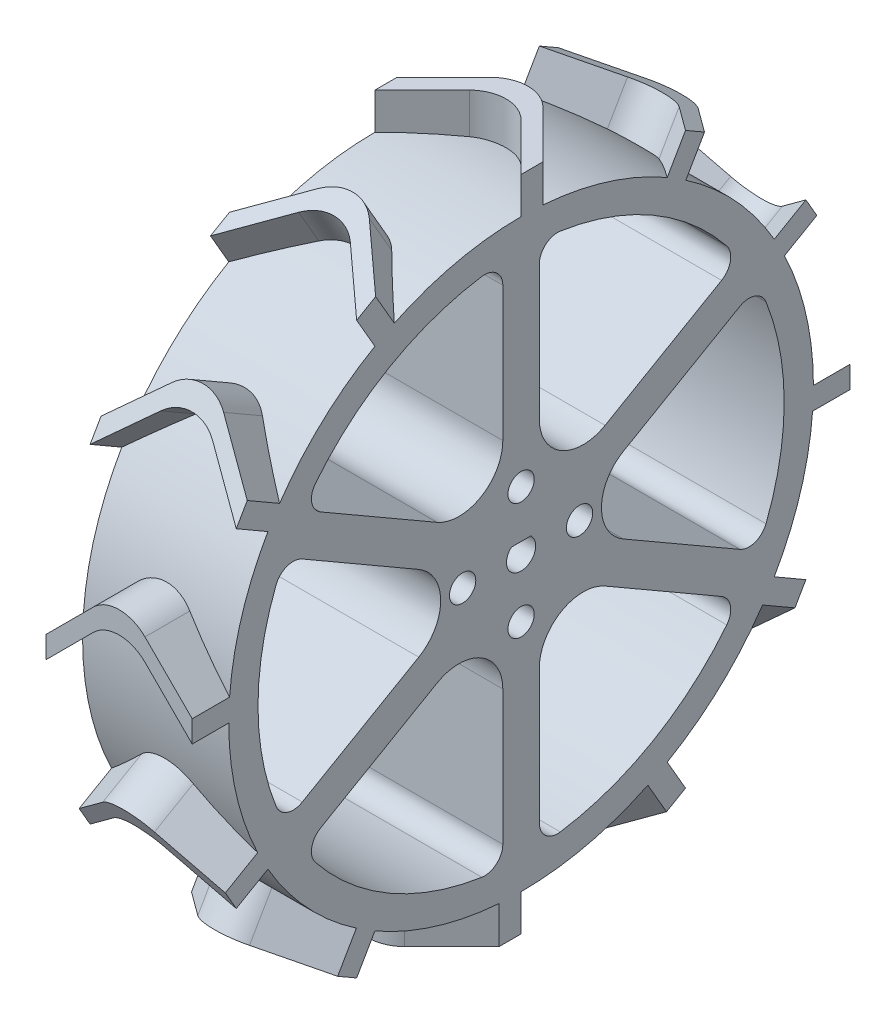
from build123d import *

# Parameters (mm, degrees)
SKETCH2_R                = 40
BOSS_EXTRUDE1_DEPTH      = 20
BOSS_EXTRUDE2_DEPTH      = 45
CIRPATTERN2_COUNT        = 12
CUT_EXTRUDE3_REACH       = 68.708
FILLET1_R                = 6
CIRPATTERN3_COUNT        = 6
FILLET1_OF_CIRPATTERN3_R = 6
CUT_EXTRUDE4_REACH       = 68.708
SKETCH6_R                = 1.7999999999999998
SKETCH6_R_2              = 1.799999999999999
SKETCH6_R_3              = 1.8000000000000003
CUT_EXTRUDE6_DEPTH       = 67.70832048552884
CUT_EXTRUDE6_DEPTH_BACK  = 67.70832048552884


with BuildPart() as part:
    # Sketch2 → Boss-Extrude1 (new body)
    with BuildSketch(Plane(origin=(0, 0, 0), x_dir=(0, 0, -1), z_dir=(1, 0, 0))):
        Circle(SKETCH2_R)
    extrude(amount=BOSS_EXTRUDE1_DEPTH)

    # Sketch4 → Boss-Extrude2 (add)
    with BuildSketch(Plane(origin=(0, 0, 0), x_dir=(1, 0, 0), z_dir=(0, 1, 0))):
        with BuildLine():
            Line((0, 0), (6.464466094067264, 6.464466094067263))
            ThreePointArc((6.464466094067264, 6.464466094067263), (10, 7.9289321881345245), (13.535533905932738, 6.464466094067263))
            Line((13.535533905932738, 6.464466094067263), (20, 0))
            Line((20, 0), (20, 3))
            Line((20, 3), (13.53553390593274, 9.464466094067264))
            ThreePointArc((13.53553390593274, 9.464466094067264), (10, 10.928932188134528), (6.464466094067261, 9.464466094067264))
            Line((6.464466094067261, 9.464466094067264), (0, 3))
            Line((0, 3), (0, 0))
        make_face()
    boss_extrude2 = extrude(amount=BOSS_EXTRUDE2_DEPTH)

    # CirPattern2: Boss-Extrude2 ×12 about axis
    cirpattern2_axis = Axis((20, 0, 0), (-1, 0, 0))
    for i in range(1, CIRPATTERN2_COUNT):
        add(boss_extrude2.rotate(cirpattern2_axis, i * 360 / CIRPATTERN2_COUNT))

    # Sketch5 → Cut-Extrude3 (cut, up to next)
    with BuildSketch(Plane.ZY, mode=Mode.PRIVATE) as cut_extrude3_sk1:
        with BuildLine():
            Line((2.499999999999992, 33.12476415010377), (2.4999999999999987, 4.330127018922181))
            Line((2.4999999999999987, 4.330127018922181), (27.436887248357948, 18.727445584512928))
            ThreePointArc((27.436887248357948, 18.727445584512928), (28.6433531155643, 20.427992739848364), (28.141132565399595, 22.451651563673586))
            ThreePointArc((28.141132565399595, 22.451651563673586), (18.000000000000025, 31.176914536239778), (5.3731343283582, 35.59676147473838))
            ThreePointArc((5.3731343283582, 35.59676147473838), (3.3694841032506733, 35.019867817571004), (2.499999999999992, 33.12476415010377))
        make_face()
    cut_extrude3_tool1 = extrude(cut_extrude3_sk1.sketch, amount=-CUT_EXTRUDE3_REACH, mode=Mode.PRIVATE) & part.part
    cut_extrude3 = cut_extrude3_tool1.solids().sort_by_distance((0, 21.473973, 12.398004))[0]
    add(cut_extrude3, mode=Mode.SUBTRACT)

    # Fillet1
    fillet1_edges = [part.edges().sort_by_distance(p)[0] for p in [
        (10, 4.330127018922181, 2.4999999999999987),
    ]]
    fillet(fillet1_edges, radius=FILLET1_R)

    # CirPattern3: Cut-Extrude3 ×6 about axis
    cirpattern3_axis = Axis((0, 0, 0), (1, 0, 0))
    for i in range(1, CIRPATTERN3_COUNT):
        add(cut_extrude3.rotate(cirpattern3_axis, i * 360 / CIRPATTERN3_COUNT), mode=Mode.SUBTRACT)

    # Fillet1 of CirPattern3
    fillet1_of_cirpattern3_edges = [part.edges().sort_by_distance(p)[0] for p in [
        (10, -4.44e-15, 4.999999999999989),
        (10, -4.330127018922186, 2.499999999999991),
        (10, -4.330127018922181, -2.4999999999999982),
        (10, 2.22e-15, -4.999999999999989),
        (10, 4.3301270189221865, -2.49999999999999),
    ]]
    fillet(fillet1_of_cirpattern3_edges, radius=FILLET1_OF_CIRPATTERN3_R)

    # Sketch6 → Cut-Extrude4 (cut, up to next)
    with BuildSketch(Plane.ZY, mode=Mode.PRIVATE) as cut_extrude4_sk1:
        with Locations((0, 8)):
            Circle(SKETCH6_R)
    cut_extrude4_tool1 = extrude(cut_extrude4_sk1.sketch, amount=-CUT_EXTRUDE4_REACH, mode=Mode.PRIVATE) & part.part
    # Sketch6 → Cut-Extrude4 (cut, up to next)
    with BuildSketch(Plane.ZY, mode=Mode.PRIVATE) as cut_extrude4_sk2:
        with Locations((8, 4.3e-16)):
            Circle(SKETCH6_R_2)
    cut_extrude4_tool2 = extrude(cut_extrude4_sk2.sketch, amount=-CUT_EXTRUDE4_REACH, mode=Mode.PRIVATE) & part.part
    # Sketch6 → Cut-Extrude4 (cut, up to next)
    with BuildSketch(Plane.ZY, mode=Mode.PRIVATE) as cut_extrude4_sk3:
        with Locations((9.8e-16, -8)):
            Circle(SKETCH6_R_3)
    cut_extrude4_tool3 = extrude(cut_extrude4_sk3.sketch, amount=-CUT_EXTRUDE4_REACH, mode=Mode.PRIVATE) & part.part
    # Sketch6 → Cut-Extrude4 (cut, up to next)
    with BuildSketch(Plane.ZY, mode=Mode.PRIVATE) as cut_extrude4_sk4:
        with Locations((-8, 6.5e-16)):
            Circle(SKETCH6_R)
    cut_extrude4_tool4 = extrude(cut_extrude4_sk4.sketch, amount=-CUT_EXTRUDE4_REACH, mode=Mode.PRIVATE) & part.part
    add(cut_extrude4_tool1.solids().sort_by_distance((0, 8, 0))[0], mode=Mode.SUBTRACT)
    add(cut_extrude4_tool2.solids().sort_by_distance((0, 0, 8))[0], mode=Mode.SUBTRACT)
    add(cut_extrude4_tool3.solids().sort_by_distance((0, -8, 0))[0], mode=Mode.SUBTRACT)
    add(cut_extrude4_tool4.solids().sort_by_distance((0, 0, -8))[0], mode=Mode.SUBTRACT)

    # Sketch8 → Cut-Extrude6 (cut, two sides: drawn at the far end of the back side and taken through both)
    with BuildSketch(Plane(origin=(0, 0, 0), x_dir=(0, 0, -1), z_dir=(1, 0, 0)).offset(-CUT_EXTRUDE6_DEPTH_BACK)):
        with BuildLine():
            Line((1.322875655532295, 1.5000000000000002), (-1.322875655532295, 1.5000000000000002))
            ThreePointArc((-1.322875655532295, 1.5000000000000002), (5.7e-16, -2), (1.322875655532295, 1.5000000000000002))
        make_face()
    extrude(amount=CUT_EXTRUDE6_DEPTH + CUT_EXTRUDE6_DEPTH_BACK, mode=Mode.SUBTRACT)


solid = part.part
